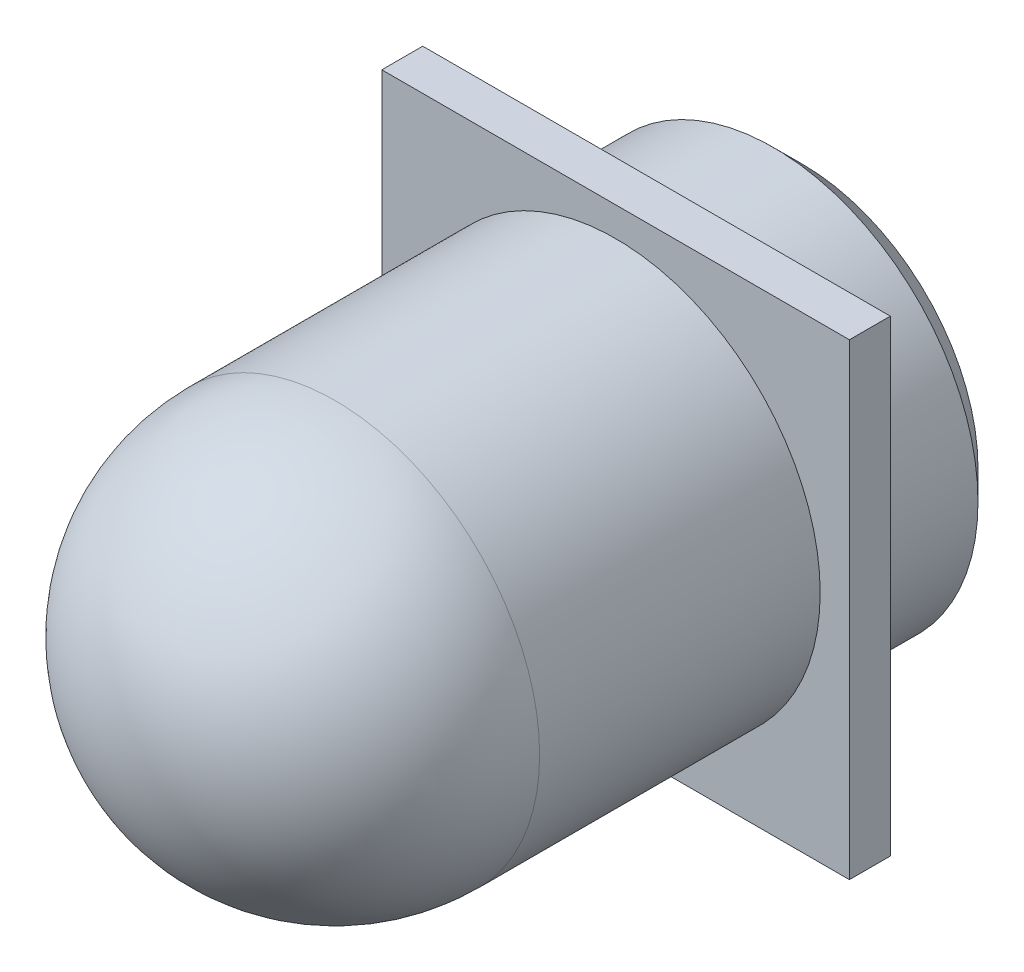
from build123d import *

# Parameters (mm, degrees)
SKETCH1_R           = 3.5
BOSS_EXTRUDE1_DEPTH = 11.5
FILLET1_R           = 3.5
SKETCH3_W           = 8
SKETCH3_H           = 8
BOSS_EXTRUDE2_DEPTH = 1.2
CHAMFER1_SIZE       = 0.5
CHAMFER2_SIZE       = 0.5


with BuildPart() as part:
    # Sketch1 → Boss-Extrude1 (new body)
    with BuildSketch(Plane.XY):
        Circle(SKETCH1_R)
    extrude(amount=BOSS_EXTRUDE1_DEPTH)

    # Fillet1
    fillet1_edges = [part.edges().sort_by_distance(p)[0] for p in [
        (-3.5, 0, 11.5),
    ]]
    fillet(fillet1_edges, radius=FILLET1_R)

    # Sketch3 → Boss-Extrude2 (add)
    with BuildSketch(Plane(origin=(0, 0, 2), x_dir=(-1, 0, 0), z_dir=(0, 0, -1))):
        Rectangle(SKETCH3_W, SKETCH3_H)
    extrude(amount=-BOSS_EXTRUDE2_DEPTH)

    # Chamfer1
    chamfer1_edges = [part.edges().sort_by_distance(p)[0] for p in [
        (-3.5, 0, 0),
    ]]
    chamfer(chamfer1_edges, length=CHAMFER1_SIZE)

    # Chamfer2
    chamfer2_edges = [part.edges().sort_by_distance(p)[0] for p in [
        (4, 0, 2),
        (0, -4, 2),
        (-4, 0, 2),
        (0, 4, 2),
    ]]
    chamfer(chamfer2_edges, length=CHAMFER2_SIZE - 0.0001)  # a hair under: the kernel refuses the full size


solid = part.part
